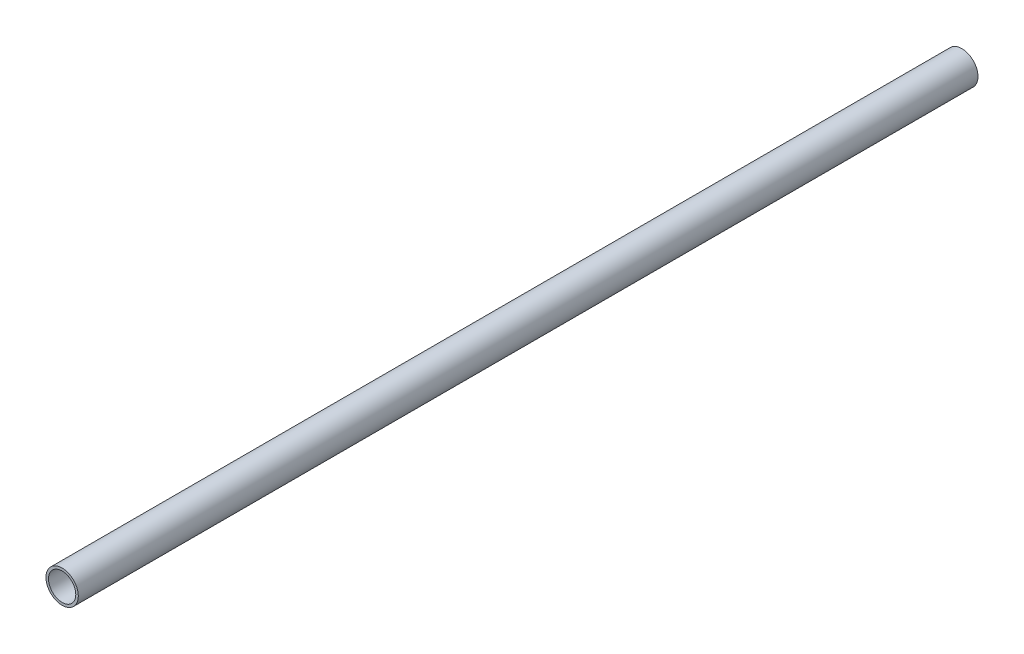
from build123d import *

# Parameters (mm, degrees)
SKETCH3_R           = 7.9375
SKETCH3_R_2         = 6.6929
BOSS_EXTRUDE1_DEPTH = 220.873816443


with BuildPart() as part:
    # Sketch3 → Boss-Extrude1 (new, symmetric)
    with BuildSketch(Plane.XY):
        Circle(SKETCH3_R)
        Circle(SKETCH3_R_2, mode=Mode.SUBTRACT)
    extrude(amount=BOSS_EXTRUDE1_DEPTH, both=True)


solid = part.part
